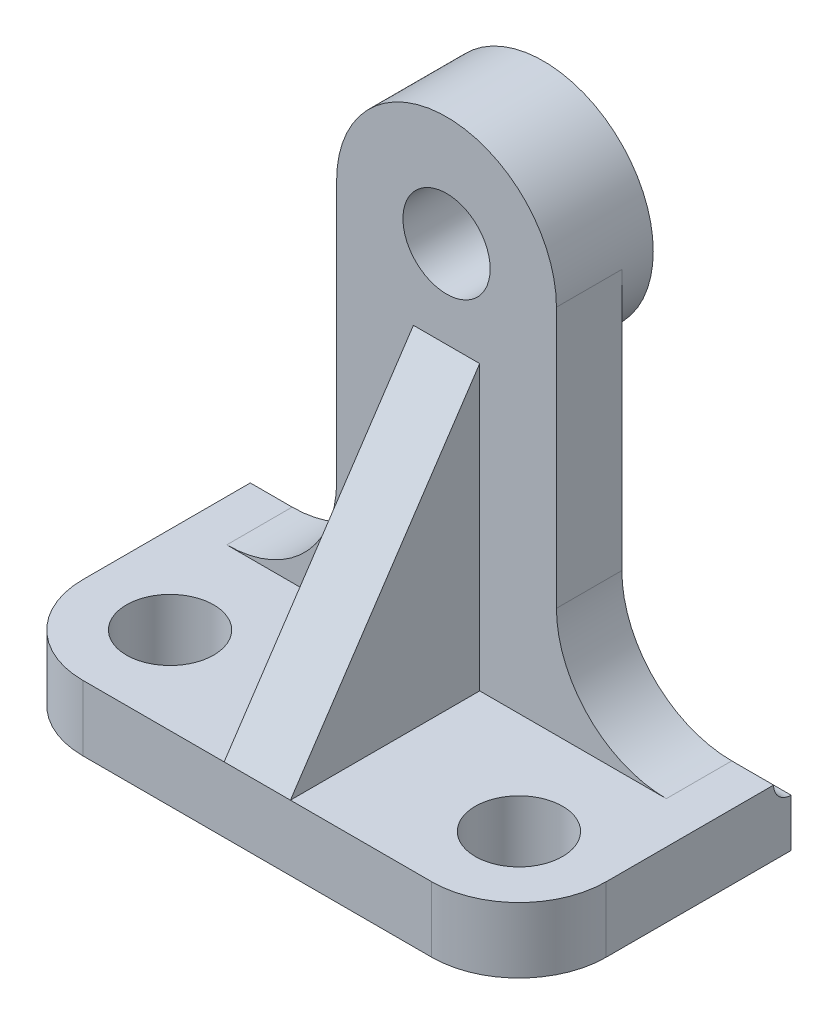
from build123d import *

# Parameters (mm, degrees)
SKETCH1_W                  = 76.2
SKETCH1_H                  = 9.525
BOSS_EXTRUDE1_DEPTH        = 39.624
FILLET1_R                  = 12.7
SKETCH2_R                  = 2.54
CUT_EXTRUDE1_DEPTH         = 87.018502558
SKETCH3_W                  = 32.004
SKETCH3_H                  = 9.525
BOSS_EXTRUDE2_DEPTH        = 53.975
FILLET2_R                  = 16.002
FILLET3_R                  = 16.002
SKETCH4_R                  = 16.002
BOSS_EXTRUDE3_DEPTH        = 14.097
BOSS_EXTRUDE4_DEPTH        = 4.826
SKETCH6_R                  = 6.35
CUT_EXTRUDE2_DEPTH         = 89.301196715
F_3_8_0_5_DIAMETER_HOLE1_D = 12.7


with BuildPart() as part:
    # Sketch1 → Boss-Extrude1 (new body)
    with BuildSketch(Plane.XY):
        Rectangle(SKETCH1_W, SKETCH1_H)
    extrude(amount=BOSS_EXTRUDE1_DEPTH)

    # Fillet1
    fillet1_edges = [part.edges().sort_by_distance(p)[0] for p in [
        (-38.1, 0, 39.624),
        (38.1, 0, 39.624),
    ]]
    fillet(fillet1_edges, radius=FILLET1_R)

    # Sketch2 → Cut-Extrude1 (cut, through all)
    with BuildSketch(Plane(origin=(38.1, 0, 0), x_dir=(0, 0, -1), z_dir=(1, 0, 0))):
        with Locations((0, 4.7625)):
            Circle(SKETCH2_R)
    extrude(amount=-CUT_EXTRUDE1_DEPTH, mode=Mode.SUBTRACT)

    # Sketch3 → Boss-Extrude2 (add)
    with BuildSketch(Plane(origin=(0, 4.7625, 0), x_dir=(1, 0, 0), z_dir=(0, 1, 0))):
        with Locations((0, -7.3025)):
            Rectangle(SKETCH3_W, SKETCH3_H)
    extrude(amount=BOSS_EXTRUDE2_DEPTH)

    # Fillet2
    fillet2_edges = [part.edges().sort_by_distance(p)[0] for p in [
        (-16.002, 4.7625, 7.3025),
    ]]
    fillet(fillet2_edges, radius=FILLET2_R)

    # Fillet3
    # the kernel refuses this fillet: 16.002 mm, written as the material it adds along each edge
    with BuildSketch(Plane(origin=(16.002, 4.7625, 2.54), x_dir=(0, 1, 0), z_dir=(0, 0, 1))) as fillet3_piece_1:
        with BuildLine():
            CenterArc((FILLET3_R, -FILLET3_R), FILLET3_R, 90, 90)
            Line((0, -FILLET3_R), (0, 0))
            Line((0, 0), (FILLET3_R, 0))
        make_face()
    extrude(amount=9.525)

    # Sketch4 → Boss-Extrude3 (add)
    with BuildSketch(Plane.XY.offset(12.065)):
        with Locations((0, 58.7375)):
            Circle(SKETCH4_R)
    extrude(amount=-BOSS_EXTRUDE3_DEPTH)

    # Sketch5 → Boss-Extrude4 (add, symmetric)
    with BuildSketch(Plane(origin=(0, 0, 0), x_dir=(0, 0, -1), z_dir=(1, 0, 0))):
        Polygon((-39.624, 4.7625), (-12.065, 4.7625), (-12.065, 46.0375), align=None)
    extrude(amount=BOSS_EXTRUDE4_DEPTH, both=True)

    # Sketch6 → Cut-Extrude2 (cut, through all)
    with BuildSketch(Plane.XY.offset(12.065)):
        with Locations((0, 58.7375)):
            Circle(SKETCH6_R)
    extrude(amount=-CUT_EXTRUDE2_DEPTH, mode=Mode.SUBTRACT)

    # 3/8 (0.5) Diameter Hole1 (through all)
    with Locations(Plane(origin=(0, 4.7625, 0), x_dir=(1, 0, 0), z_dir=(0, 1, 0))):
        with Locations((-25.4, -26.924), (25.4, -26.924)):
            Hole(F_3_8_0_5_DIAMETER_HOLE1_D / 2)


solid = part.part
